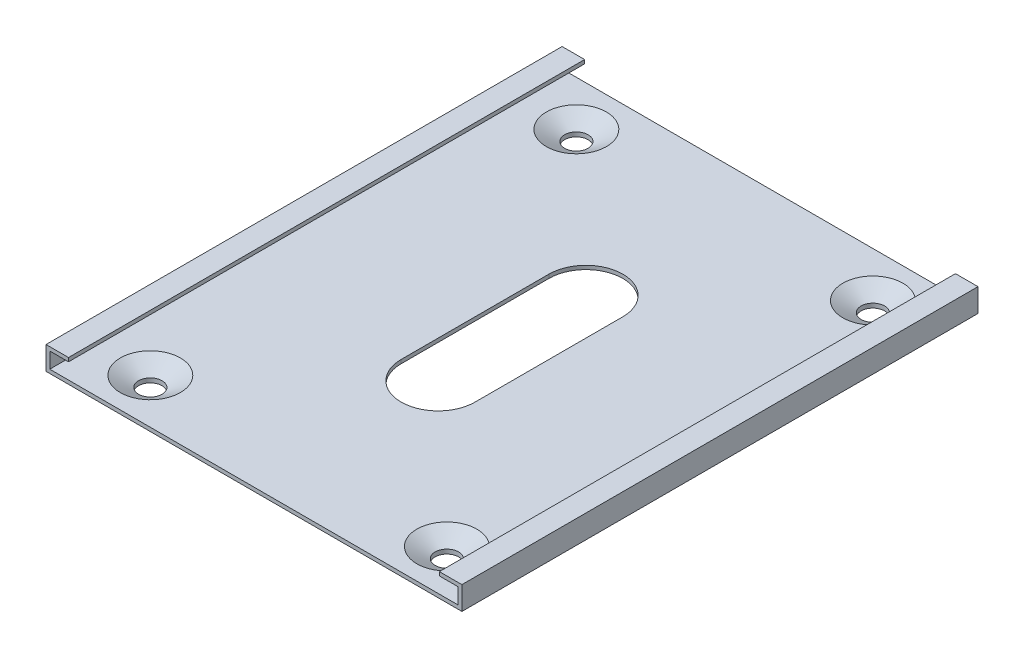
from build123d import *

# Parameters (mm, degrees)
EXTRUDE_THIN3_DEPTH     = 69.85
CUT_EXTRUDE1_DEPTH      = 76.372290574
CUT_EXTRUDE1_DEPTH_BACK = 76.372290574
SKETCH9_R               = 4.064
CUT_EXTRUDE2_DEPTH      = 2.54
LPATTERN1_COUNT         = 2
LPATTERN1_PITCH         = 40.132


# Read off the part's stored shape, not the designer's step: Mirror1
with BuildPart() as part:
    # Sketch6 → Extrude-Thin3 (new body)
    with BuildSketch(Plane.XY):
        Polygon((25.0952, 2.1336), (27.6352, 2.1336), (27.6352, 0), (-27.6352, 0), (-27.6352, 2.1336), (-25.0952, 2.1336), (-25.0952, 2.6416), (-28.1432, 2.6416), (-28.1432, -0.508), (28.1432, -0.508), (28.1432, 2.6416), (25.0952, 2.6416), align=None)
    extrude(amount=EXTRUDE_THIN3_DEPTH)

    # Sketch8 → Cut-Extrude1 (cut, two sides: drawn at the far end of the back side and taken through both)
    with BuildSketch(Plane.XZ.offset(0.508).offset(-CUT_EXTRUDE1_DEPTH_BACK)):
        with BuildLine():
            Line((5, 44.925), (5, 24.925))
            ThreePointArc((5, 24.925), (0, 19.925), (-5, 24.925))
            Line((-5, 24.925), (-5, 44.925))
            ThreePointArc((-5, 44.925), (0, 49.925), (5, 44.925))
        make_face()
    extrude(amount=CUT_EXTRUDE1_DEPTH + CUT_EXTRUDE1_DEPTH_BACK, mode=Mode.SUBTRACT)

    # Sketch9 → Cut-Extrude2 (cut)
    with BuildSketch(Plane.XZ.offset(0.508)):
        with Locations(Location((20.0152, 63.754, 0), (0, 0, 270))):
            Circle(SKETCH9_R)
    cut_extrude2 = extrude(amount=-CUT_EXTRUDE2_DEPTH, mode=Mode.SUBTRACT)

    # Sketch10 → Revolve1 (revolve)
    with BuildSketch(Plane(origin=(0, 0, 63.754), x_dir=(0, -1, 0), z_dir=(0, 0, 1)), mode=Mode.PRIVATE) as revolve1_sk:
        Polygon((0, 24.0792), (1.429807942, 21.6027), (2.016395815, 21.6027), (0, 25.0952), align=None)
    revolve1 = revolve(revolve1_sk.sketch.rotate(Axis((20.0152, 10.109887768, 63.754), (0, -1, 0)), 90), axis=Axis((20.0152, 10.109887768, 63.754), (0, -1, 0)))

    # LPattern1: Cut-Extrude2, Revolve1 ×2
    with Locations(*[(-i * LPATTERN1_PITCH, 0, 0) for i in range(1, LPATTERN1_COUNT)]):
        add(cut_extrude2, mode=Mode.SUBTRACT)
        add(revolve1)

    # Mirror1 outline → Mirror1 (revolve)
    with BuildSketch(Plane(origin=(20.0152, 0, 6.096), x_dir=(1, 0, 0), z_dir=(0, 0, 1))):
        Polygon((3.18411819, -0.508), (1.5875, -1.429807942), (1.5875, -2.016395815), (4.20011819, -0.508), align=None)
    revolve(axis=Axis((20.0152, 0, 6.096), (0, 1, 0)))

    # Mirror1 2 outline → Mirror1 2 (revolve)
    with BuildSketch(Plane(origin=(-20.1168, 0, 6.096), x_dir=(1, 0, 0), z_dir=(0, 0, 1))):
        Polygon((3.18411819, -0.508), (1.5875, -1.429807942), (1.5875, -2.016395815), (4.20011819, -0.508), align=None)
    revolve(axis=Axis((-20.1168, 0, 6.096), (0, 1, 0)))

    # Mirror1 3 outline → Mirror1 3 (revolve, cut)
    with BuildSketch(Plane(origin=(20.0152, 0, 6.096), x_dir=(1, 0, 0), z_dir=(0, 0, 1))):
        Polygon((3.18411819, -0.508), (4.064, 0), (0, 0), (0, -0.508), align=None)
    revolve(axis=Axis((20.0152, 0, 6.096), (0, 1, 0)), mode=Mode.SUBTRACT)

    # Mirror1 4 outline → Mirror1 4 (revolve, cut)
    with BuildSketch(Plane(origin=(-20.1168, 0, 6.096), x_dir=(1, 0, 0), z_dir=(0, 0, 1))):
        Polygon((3.18411819, -0.508), (4.064, 0), (0, 0), (0, -0.508), align=None)
    revolve(axis=Axis((-20.1168, 0, 6.096), (0, 1, 0)), mode=Mode.SUBTRACT)


solid = part.part
